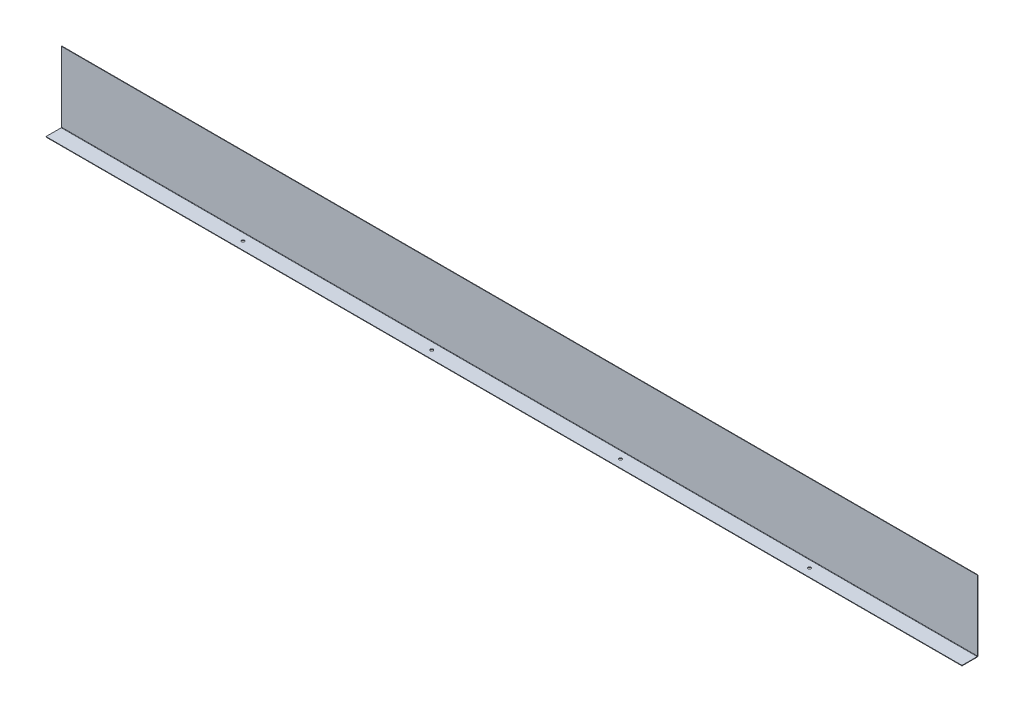
from build123d import *

# Parameters (mm, degrees)
SKETCH2_W                    = 33.9
SKETCH2_H                    = 1
BASE_FLANGE1_DEPTH           = 1940
EDGE_FLANGE2_STRIP_W         = 5.4732
EDGE_FLANGE2_STRIP_H         = 1
EDGE_FLANGE2_STRIP_CUT_DEPTH = 1940
EDGE_FLANGE2_DEPTH           = 1940
SKETCH10_R                   = 3
CUT_EXTRUDE1_DEPTH           = 10
SKETCH10_3_R                 = 3
CUT_EXTRUDE2_DEPTH           = 10


# Sheet-metal steps are written as plain solids
with BuildPart() as part:
    # Sketch2 → Base-Flange1 (new body)
    with BuildSketch(Plane(origin=(0, 0, 0), x_dir=(0, 0, -1), z_dir=(1, 0, 0))):
        with Locations((16.95, -0.5)):
            Rectangle(SKETCH2_W, SKETCH2_H)
    extrude(amount=BASE_FLANGE1_DEPTH)

    # Edge-Flange2 strip (across the edge) → Edge-Flange2 strip cut (cut)
    with BuildSketch(Plane(origin=(1940, 0, -33.9), x_dir=(0, 0, 1), z_dir=(-1, 0, 0))):
        with Locations((-1, -0.5)):
            Rectangle(EDGE_FLANGE2_STRIP_W, EDGE_FLANGE2_STRIP_H)
    extrude(amount=EDGE_FLANGE2_STRIP_CUT_DEPTH, mode=Mode.SUBTRACT)

    # Edge-Flange2 section (across the edge) → Edge-Flange2 (add)
    with BuildSketch(Plane(origin=(1940, 0, -33.9), x_dir=(0, 0, 1), z_dir=(-1, 0, 0))):
        with BuildLine():
            Line((0, 0.7366), (0, 149))
            Line((0, 149), (1, 149))
            Line((1, 149), (1, 0.7366))
            ThreePointArc((1, 0.7366), (1.215745145, 0.215745145), (1.7366, 0))
            Line((1.7366, 0), (1.7366, -1))
            ThreePointArc((1.7366, -1), (0.508638364, -0.491361636), (0, 0.7366))
        make_face()
    extrude(amount=EDGE_FLANGE2_DEPTH)

    # Sketch10 → Cut-Extrude1 (cut)
    with BuildSketch(Plane(origin=(0, 0, 0), x_dir=(1, 0, 0), z_dir=(0, 1, 0))):
        with Locations(Location((800, 16.95, 0), (0, 0, 270))):
            Circle(SKETCH10_R)
    extrude(amount=-CUT_EXTRUDE1_DEPTH, mode=Mode.SUBTRACT)

    # Sketch10<3> → Cut-Extrude2 (cut)
    with BuildSketch(Plane(origin=(0, 0, 0), x_dir=(1, 0, 0), z_dir=(0, 1, 0))):
        with Locations(Location((400, 16.95, 0), (0, 0, 270))):
            Circle(SKETCH10_3_R)
        with Locations(Location((800, 16.95, 0), (0, 0, 270))):
            Circle(SKETCH10_3_R)
        with Locations(Location((1200, 16.95, 0), (0, 0, 270))):
            Circle(SKETCH10_3_R)
        with Locations(Location((1600, 16.95, 0), (0, 0, 270))):
            Circle(SKETCH10_3_R)
    extrude(amount=-CUT_EXTRUDE2_DEPTH, mode=Mode.SUBTRACT)


solid = part.part
